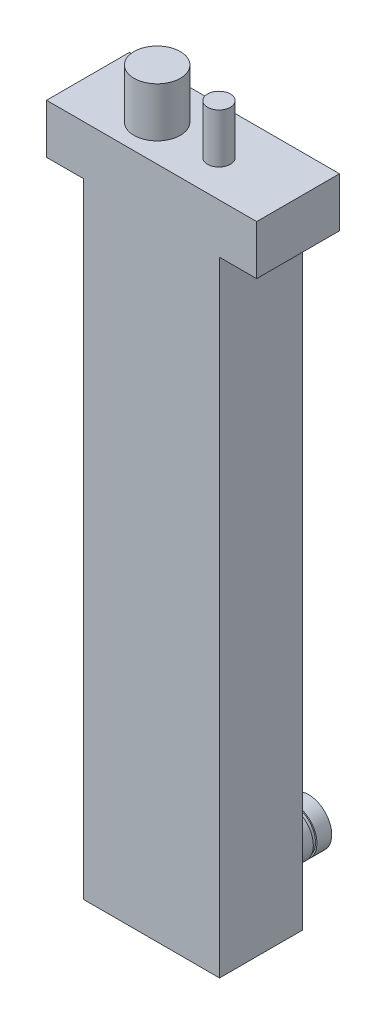
from build123d import *

# Parameters (mm, degrees)
SKETCH1_W              = 33.02
SKETCH1_H              = 19.05
BOSS_EXTRUDE1_DEPTH    = 10.16
SKETCH2_R              = 4.7625
SKETCH2_R_2            = 2.357295936
BOSS_EXTRUDE2_DEPTH    = 10.16
SKETCH5_W              = 19.05
SKETCH5_H              = 10.16
BOSS_EXTRUDE3_DEPTH    = 5.08
SKETCH6_W              = 19.05
SKETCH6_H              = 10.16
BOSS_EXTRUDE4_DEPTH    = 5.08
SKETCH7_W              = 27.94
SKETCH7_H              = 19.05
BOSS_EXTRUDE5_DEPTH    = 128.27
SKETCH9_R              = 4.7625
BOSS_EXTRUDE6_DEPTH    = 15.24
CUT_EXTRUDE3_START     = -21.717
CUT_EXTRUDE3_OUTLINE_R = 4.7625
CUT_EXTRUDE3_DEPTH     = 0.7366
SKETCH13_R             = 4.4704
BOSS_EXTRUDE8_DEPTH    = 0.7366
SKETCH14_W             = 27.94
SKETCH14_H             = 10.16
CUT_EXTRUDE4_DEPTH     = 15.24
SKETCH15_W             = 43.18
SKETCH15_H             = 138.43
CUT_EXTRUDE5_DEPTH     = 2.032


# Read off the part's stored shape, not the designer's step: Cut-Extrude3
with BuildPart() as part:
    # Sketch1 → Boss-Extrude1 (new body)
    with BuildSketch(Plane(origin=(0, 0, 0), x_dir=(1, 0, 0), z_dir=(0, 1, 0))):
        with Locations((-5.08, 0)):
            Rectangle(SKETCH1_W, SKETCH1_H)
    extrude(amount=BOSS_EXTRUDE1_DEPTH)

    # Sketch2 → Boss-Extrude2 (add)
    with BuildSketch(Plane(origin=(0, 10.16, 0), x_dir=(1, 0, 0), z_dir=(0, 1, 0))):
        with Locations(Location((-11.43, 0, 0), (0, 0, 270))):
            Circle(SKETCH2_R)
        with Locations(Location((1.27, 0, 0), (0, 0, 270))):
            Circle(SKETCH2_R_2)
    extrude(amount=BOSS_EXTRUDE2_DEPTH)

    # Sketch5 → Boss-Extrude3 (add)
    with BuildSketch(Plane.ZY.offset(21.59)):
        with Locations((0, 5.08)):
            Rectangle(SKETCH5_W, SKETCH5_H)
    extrude(amount=BOSS_EXTRUDE3_DEPTH)

    # Sketch6 → Boss-Extrude4 (add)
    with BuildSketch(Plane(origin=(11.43, 0, 0), x_dir=(0, 0, -1), z_dir=(1, 0, 0))):
        with Locations((0, 5.08)):
            Rectangle(SKETCH6_W, SKETCH6_H)
    extrude(amount=BOSS_EXTRUDE4_DEPTH)

    # Sketch7 → Boss-Extrude5 (add)
    with BuildSketch(Plane(origin=(0, 0, 0), x_dir=(-1, 0, 0), z_dir=(0, -1, 0))):
        with Locations((5.08, 0)):
            Rectangle(SKETCH7_W, SKETCH7_H)
    extrude(amount=BOSS_EXTRUDE5_DEPTH)

    # Sketch9 → Boss-Extrude6 (add)
    with BuildSketch(Plane.XY.offset(9.525)):
        with Locations(Location((-5.08, -123.5075, 0), (0, 0, 270))):
            Circle(SKETCH9_R)
    boss_extrude6 = extrude(amount=BOSS_EXTRUDE6_DEPTH)

    # Mirror5: Boss-Extrude6 across plane
    add(boss_extrude6.mirror(Plane.XY))

    # Cut-Extrude3 outline → Cut-Extrude3 (cut)
    with BuildSketch(Plane.XY.offset(CUT_EXTRUDE3_START)):
        with Locations((-5.08, -123.5075)):
            Circle(CUT_EXTRUDE3_OUTLINE_R)
    extrude(amount=CUT_EXTRUDE3_DEPTH, mode=Mode.SUBTRACT)

    # Sketch13 → Boss-Extrude8 (add)
    with BuildSketch(Plane(origin=(0, 0, -20.9804), x_dir=(-1, 0, 0), z_dir=(0, 0, -1))):
        with Locations(Location((5.08, -123.5075, 0), (0, 0, 180))):
            Circle(SKETCH13_R)
    extrude(amount=BOSS_EXTRUDE8_DEPTH)

    # Sketch14 → Cut-Extrude4 (cut)
    with BuildSketch(Plane.XY.offset(9.525)):
        with Locations((-5.08, -123.19)):
            Rectangle(SKETCH14_W, SKETCH14_H)
    extrude(amount=CUT_EXTRUDE4_DEPTH, mode=Mode.SUBTRACT)

    # Sketch15 → Cut-Extrude5 (cut)
    with BuildSketch(Plane.XY.offset(9.525)):
        with Locations((-5.08, -59.055)):
            Rectangle(SKETCH15_W, SKETCH15_H)
    extrude(amount=-CUT_EXTRUDE5_DEPTH, mode=Mode.SUBTRACT)


solid = part.part
